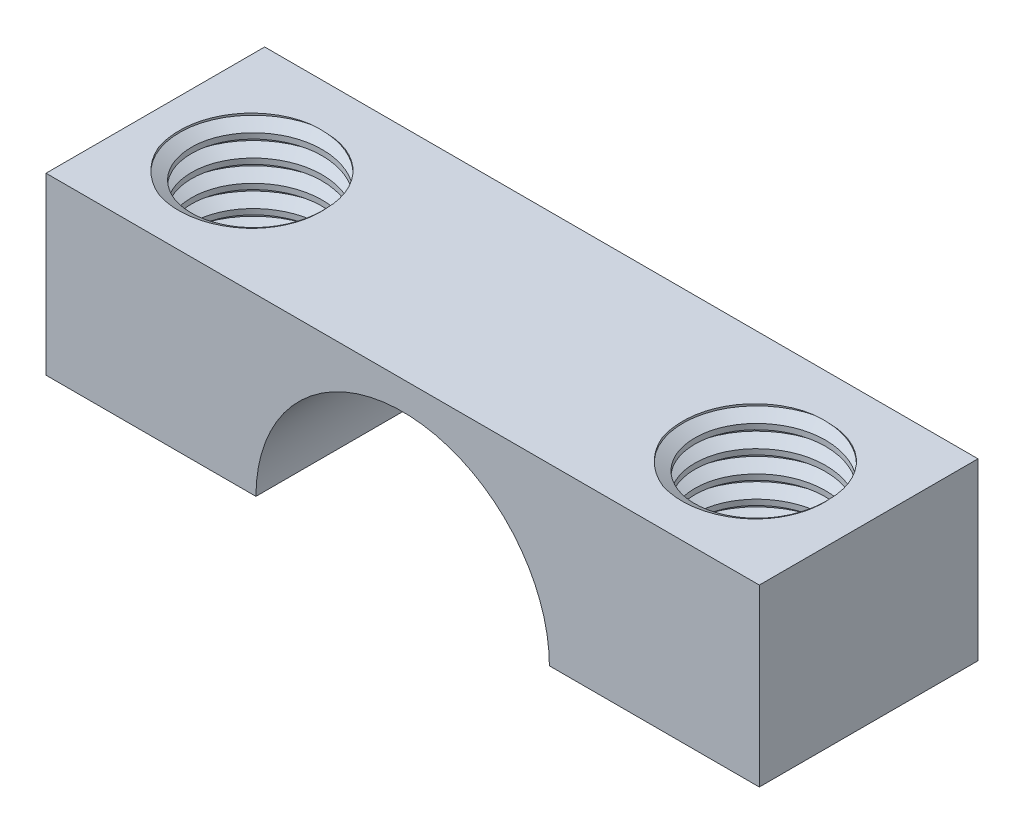
from build123d import *

# Parameters (mm, degrees)
SKETCH1_W                = 16.31
SKETCH1_H                = 4
BOSS_EXTRUDE3_DEPTH      = 5
CUT_EXTRUDE9_DEPTH       = 5
CUT_EXTRUDE10_DEPTH      = 2.5
CUT_EXTRUDE10_DEPTH_BACK = 2.5
SKETCH4_R                = 1.5
THREAD1_PITCH            = 0.5
THREAD2_PITCH            = 0.5


with BuildPart() as part:
    # Sketch1 → Boss-Extrude3 (new body)
    with BuildSketch(Plane.XY):
        Rectangle(SKETCH1_W, SKETCH1_H)
    extrude(amount=-BOSS_EXTRUDE3_DEPTH)

    # Sketch3 → Cut-Extrude9 (cut)
    with BuildSketch(Plane.XY):
        with BuildLine():
            Line((-3.355, -2), (3.355, -2))
            ThreePointArc((3.355, -2), (0, 1.355), (-3.355, -2))
        make_face()
    extrude(amount=-CUT_EXTRUDE9_DEPTH, mode=Mode.SUBTRACT)

    # Sketch4 → Cut-Extrude10 (cut, two sides: drawn at the far end of the back side and taken through both)
    with BuildSketch(Plane(origin=(0, 0, 0), x_dir=(1, 0, 0), z_dir=(0, 1, 0)).offset(-CUT_EXTRUDE10_DEPTH_BACK)):
        with Locations(Location((-5.755, 2.5, 0), (0, 0, 90))):
            Circle(SKETCH4_R)
        with Locations(Location((5.755, 2.5, 0), (0, 0, 90))):
            Circle(SKETCH4_R)
    extrude(amount=CUT_EXTRUDE10_DEPTH + CUT_EXTRUDE10_DEPTH_BACK, mode=Mode.SUBTRACT)

    # Thread1: the profile of Thread Profile1 profile screwed along a right-hand helix of 10 turns, 6 arcs to a turn; built about Z, then put on its axis
    thread1_z = Axis((0, 0, 0), (0, 0, 1))
    thread1_corners = [(1.4997, 0, -0.000173205), (1.770632937, 0, 0.156249999), (1.770632937, 0, 0.218749999), (1.4997, 0, 0.375173204)]
    with BuildLine(mode=Mode.PRIVATE) as thread1_profile:
        Line(thread1_corners[0], thread1_corners[1])
        Line(thread1_corners[1], thread1_corners[2])
        Line(thread1_corners[2], thread1_corners[3])
        Line(thread1_corners[3], thread1_corners[0])
    thread1_cap = Face(thread1_profile.wire())
    thread1_turn_angles = [0, 30, 60, 90, 120, 150, 180, 210, 240, 270, 300, 330, 360]
    thread1_turn_weights = [1, 0.8660254037844387, 1, 0.8660254037844387, 1, 0.8660254037844387, 1, 0.8660254037844387, 1, 0.8660254037844387, 1, 0.8660254037844387, 1]
    thread1_turn_rails = [Edge.make_bspline([Vector(p[0], p[1], 0).rotate(thread1_z, thread1_turn_angles[k]) / thread1_turn_weights[k] + Vector(0, 0, p[2] + THREAD1_PITCH * thread1_turn_angles[k] / 360) for k in range(13)], [0, 0, 0, 1, 1, 2, 2, 3, 3, 4, 4, 5, 5, 6, 6, 6], 2, thread1_turn_weights) for p in thread1_corners]
    thread1_turn_sides = [Face.make_surface_from_curves(thread1_turn_rails[p[0]], thread1_turn_rails[p[1]]) for p in [(0, 1), (1, 2), (2, 3), (3, 0)]]
    thread1 = Plane(origin=(-5.755, -2, -2.5), x_dir=(1, 0, 0), z_dir=(0, 1, 0)) * Solid(Shell([*[p.moved(Location((0, 0, THREAD1_PITCH * i))) for i in range(10) for p in thread1_turn_sides], thread1_cap, thread1_cap.rotate(thread1_z, 3600).moved(Location((0, 0, THREAD1_PITCH * 3600 / 360)))]))
    add(thread1, mode=Mode.SUBTRACT)

    # Thread2: the profile of Thread Profile2 profile screwed along a right-hand helix of 10 turns, 6 arcs to a turn; built about Z, then put on its axis
    thread2_z = Axis((0, 0, 0), (0, 0, 1))
    thread2_corners = [(1.4997, 0, -0.000173205), (1.770632937, 0, 0.156249999), (1.770632937, 0, 0.218749999), (1.4997, 0, 0.375173204)]
    with BuildLine(mode=Mode.PRIVATE) as thread2_profile:
        Line(thread2_corners[0], thread2_corners[1])
        Line(thread2_corners[1], thread2_corners[2])
        Line(thread2_corners[2], thread2_corners[3])
        Line(thread2_corners[3], thread2_corners[0])
    thread2_cap = Face(thread2_profile.wire())
    thread2_turn_angles = [0, 30, 60, 90, 120, 150, 180, 210, 240, 270, 300, 330, 360]
    thread2_turn_weights = [1, 0.8660254037844387, 1, 0.8660254037844387, 1, 0.8660254037844387, 1, 0.8660254037844387, 1, 0.8660254037844387, 1, 0.8660254037844387, 1]
    thread2_turn_rails = [Edge.make_bspline([Vector(p[0], p[1], 0).rotate(thread2_z, thread2_turn_angles[k]) / thread2_turn_weights[k] + Vector(0, 0, p[2] + THREAD2_PITCH * thread2_turn_angles[k] / 360) for k in range(13)], [0, 0, 0, 1, 1, 2, 2, 3, 3, 4, 4, 5, 5, 6, 6, 6], 2, thread2_turn_weights) for p in thread2_corners]
    thread2_turn_sides = [Face.make_surface_from_curves(thread2_turn_rails[p[0]], thread2_turn_rails[p[1]]) for p in [(0, 1), (1, 2), (2, 3), (3, 0)]]
    thread2 = Plane(origin=(5.755, -2, -2.5), x_dir=(1, 0, 0), z_dir=(0, 1, 0)) * Solid(Shell([*[p.moved(Location((0, 0, THREAD2_PITCH * i))) for i in range(10) for p in thread2_turn_sides], thread2_cap, thread2_cap.rotate(thread2_z, 3600).moved(Location((0, 0, THREAD2_PITCH * 3600 / 360)))]))
    add(thread2, mode=Mode.SUBTRACT)


solid = part.part
